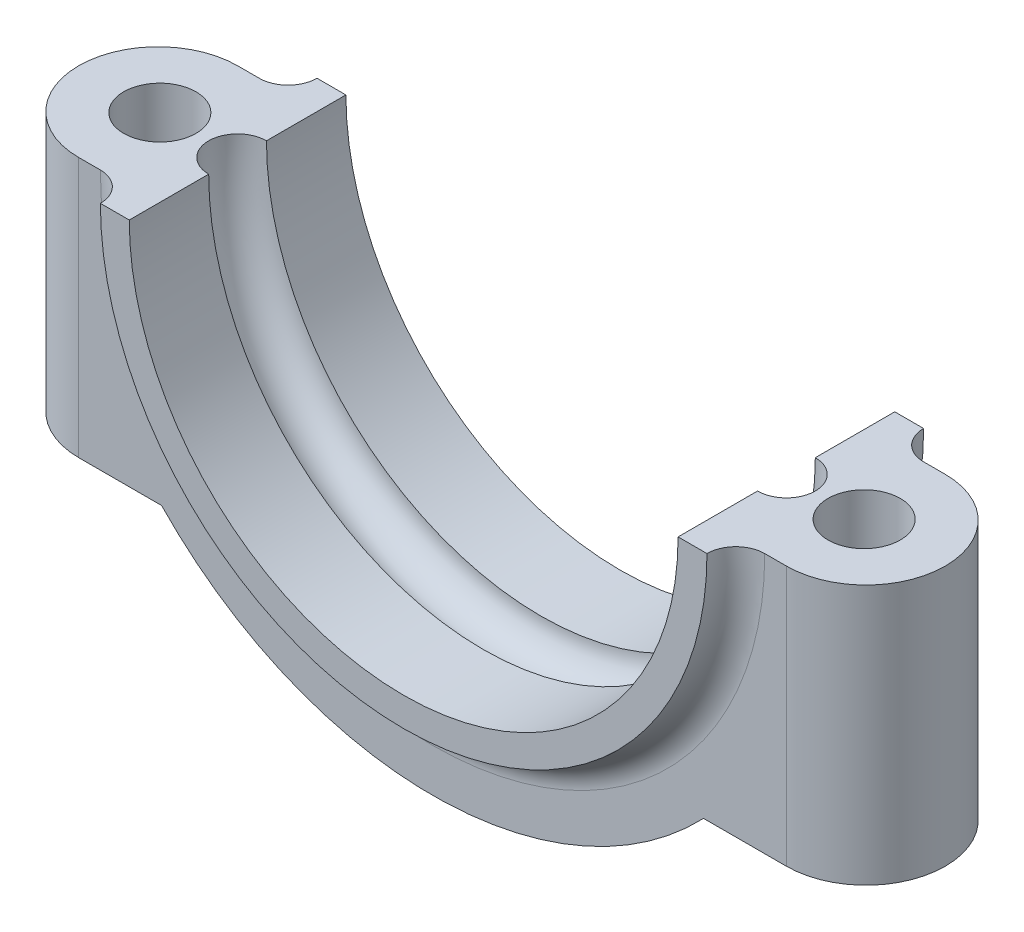
from build123d import *

# Parameters (mm, degrees)
BOSS_EXTRUDE1_DEPTH = 5.5
BOSS_EXTRUDE2_DEPTH = 7.5
SKETCH4_R           = 2.5
CUT_EXTRUDE1_DEPTH  = 41.401113846
FILLET1_R           = 2
SKETCH5_R           = 2
FILLET2_RADIUS      = 5.5
FILLET2_LENGTH      = 18
FILLET3_RADIUS      = 5.5
FILLET3_LENGTH      = 18


with BuildPart() as part:
    # Sketch1 → Boss-Extrude1 (new, symmetric)
    with BuildSketch(Plane.XY):
        with BuildLine():
            Line((19, 0), (30, 0))
            Line((30, 0), (30, -18))
            Line((30, -18), (18.761663039, -18))
            ThreePointArc((18.761663039, -18), (0, -26), (-18.761663039, -18))
            Line((-18.761663039, -18), (-30, -18))
            Line((-30, -18), (-30, 0))
            Line((-30, 0), (-19, 0))
            ThreePointArc((-19, 0), (0, -19), (19, 0))
        make_face()
    extrude(amount=BOSS_EXTRUDE1_DEPTH, both=True)

    # Sketch3 → Boss-Extrude2 (add, symmetric)
    with BuildSketch(Plane.XY):
        with BuildLine():
            Line((-21, 0), (-19, 0))
            ThreePointArc((-19, 0), (0, -19), (19, 0))
            Line((19, 0), (21, 0))
            ThreePointArc((21, 0), (0, -21), (-21, 0))
        make_face()
    extrude(amount=BOSS_EXTRUDE2_DEPTH, both=True)

    # Sketch4 → Cut-Extrude1 (cut, through all)
    with BuildSketch(Plane(origin=(0, 0, 0), x_dir=(1, 0, 0), z_dir=(0, 1, 0))):
        with Locations(Location((-24.38083152, 0, 0), (0, 0, 180))):
            Circle(SKETCH4_R)
        with Locations(Location((24.38083152, 0, 0), (0, 0, 180))):
            Circle(SKETCH4_R)
    extrude(amount=-CUT_EXTRUDE1_DEPTH, mode=Mode.SUBTRACT)

    # Fillet1
    fillet1_edges = [part.edges().sort_by_distance(p)[0] for p in [
        (0, -21, -5.5),
        (0, -21, 5.5),
    ]]
    fillet(fillet1_edges, radius=FILLET1_R - 0.0001)  # a hair under: the kernel refuses the full size

    # Sketch5 → Cut-Revolve1 (revolve, cut)
    with BuildSketch(Plane(origin=(0, 0, 0), x_dir=(1, 0, 0), z_dir=(0, 1, 0))):
        with Locations((19, 0)):
            Circle(SKETCH5_R)
    revolve(axis=Axis((0, 0, -5.716287215), (0, 0, 1)), mode=Mode.SUBTRACT)

    # Fillet2: full round fillet: the end face becomes a half cylinder, R = half its width
    fillet2_face = Plane((30, -9, 0), x_dir=(0, 1, 0), z_dir=(1, 0, 0))  # on the end face: x along it, z out of the body
    fillet2_slab = fillet2_face.offset(-FILLET2_RADIUS / 2) * Box(FILLET2_LENGTH, 2 * FILLET2_RADIUS, FILLET2_RADIUS, mode=Mode.PRIVATE)  # the body's end, R deep
    fillet2_round = Plane((24.5, -9, 0), x_dir=(1, 0, 0), z_dir=(0, 1, 0)) * Cylinder(FILLET2_RADIUS, FILLET2_LENGTH, mode=Mode.PRIVATE)  # its axis R under the face
    add(fillet2_slab - fillet2_round, mode=Mode.SUBTRACT)

    # Fillet3: full round fillet: the end face becomes a half cylinder, R = half its width
    fillet3_face = Plane((-30, -9, 0), x_dir=(0, 1, 0), z_dir=(-1, 0, 0))  # on the end face: x along it, z out of the body
    fillet3_slab = fillet3_face.offset(-FILLET3_RADIUS / 2) * Box(FILLET3_LENGTH, 2 * FILLET3_RADIUS, FILLET3_RADIUS, mode=Mode.PRIVATE)  # the body's end, R deep
    fillet3_round = Plane((-24.5, -9, 0), x_dir=(-1, 0, 0), z_dir=(0, 1, 0)) * Cylinder(FILLET3_RADIUS, FILLET3_LENGTH, mode=Mode.PRIVATE)  # its axis R under the face
    add(fillet3_slab - fillet3_round, mode=Mode.SUBTRACT)


solid = part.part
